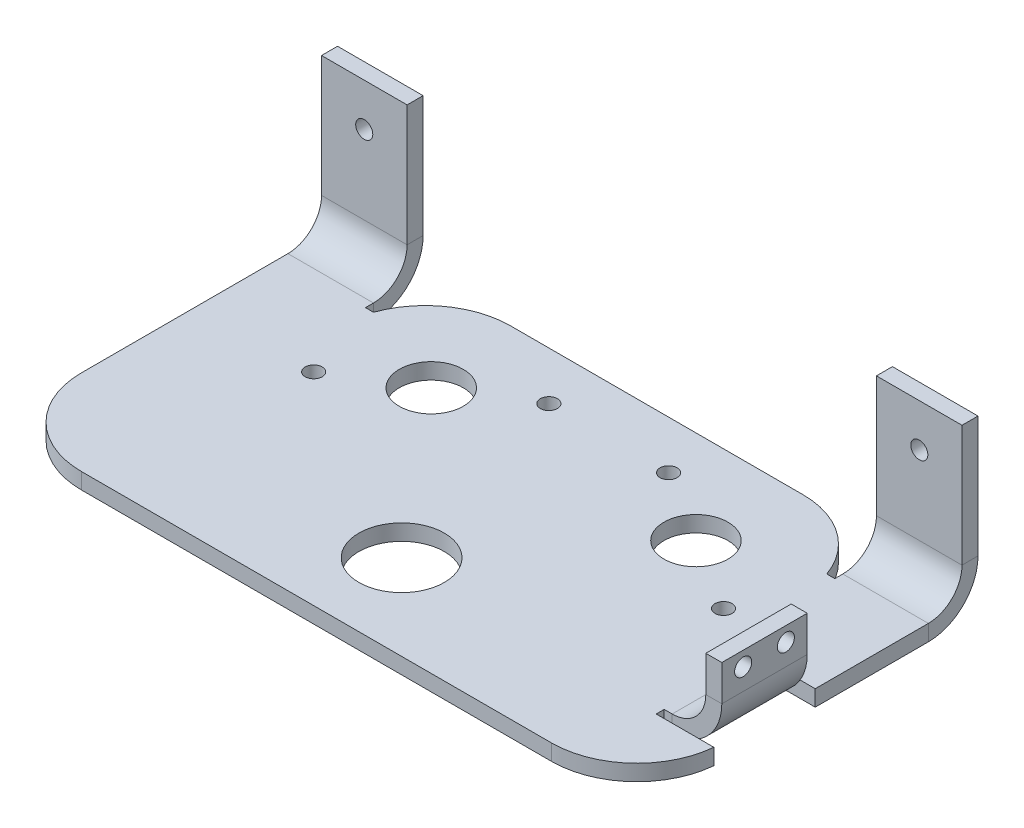
from build123d import *

# Parameters (mm, degrees)
SKETCH1_W                     = 190.5
SKETCH1_H                     = 101.6
BOSS_EXTRUDE1_DEPTH           = 1.5875
CONVERT_SOLID1_START          = -95.25
CONVERT_SOLID1_OUTLINE_W      = 3.175
CONVERT_SOLID1_OUTLINE_H      = 101.6
CONVERT_SOLID1_DEPTH          = 190.5
SKETCH35_W                    = 139.601875342
SKETCH35_H                    = 6.35
CUT_EXTRUDE7_DEPTH            = 0.254
EDGE_FLANGE1_STRIP_W          = 39.05
EDGE_FLANGE1_STRIP_H          = 4.7625
EDGE_FLANGE1_STRIP_CUT_DEPTH  = 25.449062329
EDGE_FLANGE1_RELIEF_W         = 41.43125
EDGE_FLANGE1_RELIEF_H         = 2.38125
EDGE_FLANGE1_RELIEF_CUT_DEPTH = 4.7625
EDGE_FLANGE1_DEPTH            = 25.449062329
EDGE_FLANGE2_STRIP_W          = 39.05
EDGE_FLANGE2_STRIP_H          = 4.7625
EDGE_FLANGE2_STRIP_CUT_DEPTH  = 25.449062329
EDGE_FLANGE2_RELIEF_W         = 41.43125
EDGE_FLANGE2_RELIEF_H         = 2.38125
EDGE_FLANGE2_RELIEF_CUT_DEPTH = 4.7625
EDGE_FLANGE2_DEPTH            = 25.449062329
SKETCH50_R                    = 12.713493351
CUT_EXTRUDE9_DEPTH            = 5.08
FILLET1_R                     = 25.4
CUT_EXTRUDE11_START           = -4.7625
CUT_EXTRUDE11_OUTLINE_W       = 6.35
CUT_EXTRUDE11_OUTLINE_H       = 0.00254
CUT_EXTRUDE11_OUTLINE_H_2     = 0.000254
CUT_EXTRUDE11_DEPTH           = 4.7625
EDGE_FLANGE3_STRIP_W          = 39.05
EDGE_FLANGE3_STRIP_H          = 4.7625
EDGE_FLANGE3_STRIP_CUT_DEPTH  = 25.4
EDGE_FLANGE3_RELIEF_W         = 41.43125
EDGE_FLANGE3_RELIEF_H         = 2.38125
EDGE_FLANGE3_RELIEF_CUT_DEPTH = 4.7625
EDGE_FLANGE3_DEPTH            = 25.4
SKETCH55_R                    = 2.54
CUT_EXTRUDE12_DEPTH           = 4.7625
FILLET2_R                     = 25.4
SKETCH56_R                    = 2.54
CUT_EXTRUDE13_DEPTH           = 4.7625
SKETCH57_R                    = 9.525
SKETCH57_R_2                  = 2.54
CUT_EXTRUDE14_DEPTH           = 4.7625


# Read off the part's stored shape, not the designer's step: Convert-Solid1, Cut-Extrude11
# Sheet-metal steps are written as plain solids
with BuildPart() as part:
    # Sketch1 → Boss-Extrude1 (new body)
    with BuildSketch(Plane(origin=(0, 0, 0), x_dir=(1, 0, 0), z_dir=(0, 1, 0))):
        Rectangle(SKETCH1_W, SKETCH1_H)
    extrude(amount=BOSS_EXTRUDE1_DEPTH)

    # Convert-Solid1 outline → Convert-Solid1 (add)
    with BuildSketch(Plane.YZ.offset(CONVERT_SOLID1_START)):
        with Locations((-1.5875, 0)):
            Rectangle(CONVERT_SOLID1_OUTLINE_W, CONVERT_SOLID1_OUTLINE_H)
    extrude(amount=CONVERT_SOLID1_DEPTH)

    # Sketch35 → Cut-Extrude7 (cut)
    with BuildSketch(Plane(origin=(0, 0, -50.8), x_dir=(-1, 0, 0), z_dir=(0, 0, -1))):
        Rectangle(SKETCH35_W, SKETCH35_H)
    extrude(amount=-CUT_EXTRUDE7_DEPTH, mode=Mode.SUBTRACT)

    # Edge-Flange1 strip (across the edge) → Edge-Flange1 strip cut (cut)
    with BuildSketch(Plane(origin=(95.25, 1.5875, -50.8), x_dir=(0, 0, 1), z_dir=(-1, 0, 0))):
        with Locations((-4.7625, -2.38125)):
            Rectangle(EDGE_FLANGE1_STRIP_W, EDGE_FLANGE1_STRIP_H)
    extrude(amount=EDGE_FLANGE1_STRIP_CUT_DEPTH, mode=Mode.SUBTRACT)

    # Edge-Flange1 relief (on the sheet) → Edge-Flange1 relief cut (cut)
    with BuildSketch(Plane(origin=(95.25, 1.5875, -36.0375), x_dir=(0, 0, 1), z_dir=(0, 1, 0))):
        with Locations((-18.334375, -26.639687329)):
            Rectangle(EDGE_FLANGE1_RELIEF_W, EDGE_FLANGE1_RELIEF_H)
    extrude(amount=-EDGE_FLANGE1_RELIEF_CUT_DEPTH, mode=Mode.SUBTRACT)

    # Edge-Flange1 section (across the edge) → Edge-Flange1 (add)
    with BuildSketch(Plane(origin=(95.25, 1.5875, -50.8), x_dir=(0, 0, 1), z_dir=(-1, 0, 0))):
        with BuildLine():
            Line((0, 10), (0, 46.0375))
            Line((0, 46.0375), (4.7625, 46.0375))
            Line((4.7625, 46.0375), (4.7625, 10))
            ThreePointArc((4.7625, 10), (7.691432188, 2.928932188), (14.7625, 0))
            Line((14.7625, 0), (14.7625, -4.7625))
            ThreePointArc((14.7625, -4.7625), (4.323836143, -0.438663857), (0, 10))
        make_face()
    extrude(amount=EDGE_FLANGE1_DEPTH)

    # Edge-Flange2 strip (across the edge) → Edge-Flange2 strip cut (cut)
    with BuildSketch(Plane(origin=(-69.800937671, 1.5875, -50.8), x_dir=(0, 0, 1), z_dir=(-1, 0, 0))):
        with Locations((-4.7625, -2.38125)):
            Rectangle(EDGE_FLANGE2_STRIP_W, EDGE_FLANGE2_STRIP_H)
    extrude(amount=EDGE_FLANGE2_STRIP_CUT_DEPTH, mode=Mode.SUBTRACT)

    # Edge-Flange2 relief (on the sheet) → Edge-Flange2 relief cut (cut)
    with BuildSketch(Plane(origin=(-69.800937671, 1.5875, -36.0375), x_dir=(0, 0, 1), z_dir=(0, 1, 0))):
        with Locations((-18.334375, 1.190625)):
            Rectangle(EDGE_FLANGE2_RELIEF_W, EDGE_FLANGE2_RELIEF_H)
    extrude(amount=-EDGE_FLANGE2_RELIEF_CUT_DEPTH, mode=Mode.SUBTRACT)

    # Edge-Flange2 section (across the edge) → Edge-Flange2 (add)
    with BuildSketch(Plane(origin=(-69.800937671, 1.5875, -50.8), x_dir=(0, 0, 1), z_dir=(-1, 0, 0))):
        with BuildLine():
            Line((0, 10), (0, 46.0375))
            Line((0, 46.0375), (4.7625, 46.0375))
            Line((4.7625, 46.0375), (4.7625, 10))
            ThreePointArc((4.7625, 10), (7.691432188, 2.928932188), (14.7625, 0))
            Line((14.7625, 0), (14.7625, -4.7625))
            ThreePointArc((14.7625, -4.7625), (4.323836143, -0.438663857), (0, 10))
        make_face()
    extrude(amount=EDGE_FLANGE2_DEPTH)

    # Sketch50 → Cut-Extrude9 (cut)
    with BuildSketch(Plane(origin=(0, -3.175, 0), x_dir=(-1, 0, 0), z_dir=(0, -1, 0))):
        with Locations(Location((0, -25.4, 0), (0, 0, 90))):
            Circle(SKETCH50_R)
    extrude(amount=-CUT_EXTRUDE9_DEPTH, mode=Mode.SUBTRACT)

    # Fillet1
    # the kernel refuses this fillet: 25.4 mm, written as the material it takes off along each edge
    with BuildSketch(Plane(origin=(-67.419687671, 61.417239936, -50.546), x_dir=(1, 0, 0), z_dir=(0, -1, 0))) as fillet1_piece_1:
        with BuildLine():
            CenterArc((23.931895975, 25.4), FILLET1_R, 199.575530564, 70.424469436)
            Line((0, 16.88975), (-0.478637919, 16.719545))
            ThreePointArc((-0.478637919, 16.719545), (-0.508, 8.444875), (-0.508, 0))
            Line((-0.508, 0), (0, -0.508))
            Line((0, -0.508), (23.931895975, -0.508))
            Line((23.931895975, -0.508), (23.931895975, 0))
        make_face()
    extrude(amount=124.421979873, mode=Mode.SUBTRACT)
    with BuildSketch(Plane(origin=(67.419687671, 61.417239936, -50.546), x_dir=(0, 0, 1), z_dir=(0, -1, 0))) as fillet1_piece_2:
        with BuildLine():
            CenterArc((25.4, 23.931895975), FILLET1_R, 180, 70.424469436)
            Line((0, 23.931895975), (-0.508, 23.931895975))
            Line((-0.508, 23.931895975), (-0.508, 0))
            Line((-0.508, 0), (0, -0.508))
            ThreePointArc((0, -0.508), (8.444875, -0.508), (16.719545, -0.478637919))
            Line((16.719545, -0.478637919), (16.88975, 0))
        make_face()
    extrude(amount=124.421979873, mode=Mode.SUBTRACT)

    # Cut-Extrude11 outline → Cut-Extrude11 (cut)
    with BuildSketch(Plane.XZ.offset(3.175).offset(CUT_EXTRUDE11_START)):
        with Locations((92.075, -0.001524)):
            Rectangle(CUT_EXTRUDE11_OUTLINE_W, CUT_EXTRUDE11_OUTLINE_H)
        with Locations((92.075, 25.399873)):
            Rectangle(CUT_EXTRUDE11_OUTLINE_W, CUT_EXTRUDE11_OUTLINE_H_2)
    extrude(amount=CUT_EXTRUDE11_DEPTH, mode=Mode.SUBTRACT)

    # Edge-Flange3 strip (across the edge) → Edge-Flange3 strip cut (cut)
    with BuildSketch(Plane(origin=(95.25, 1.5875, 25.399746), x_dir=(-1, 0, 0), z_dir=(0, 0, -1))):
        with Locations((-4.7625, -2.38125)):
            Rectangle(EDGE_FLANGE3_STRIP_W, EDGE_FLANGE3_STRIP_H)
    extrude(amount=EDGE_FLANGE3_STRIP_CUT_DEPTH, mode=Mode.SUBTRACT)

    # Edge-Flange3 relief (on the sheet) → Edge-Flange3 relief cut (cut)
    with BuildSketch(Plane(origin=(80.4875, 1.5875, 25.399746), x_dir=(-1, 0, 0), z_dir=(0, 1, 0))):
        with Locations((-18.334375, 1.190625)):
            Rectangle(EDGE_FLANGE3_RELIEF_W, EDGE_FLANGE3_RELIEF_H)
        with Locations((-18.334375, -26.590625)):
            Rectangle(EDGE_FLANGE3_RELIEF_W, EDGE_FLANGE3_RELIEF_H)
    extrude(amount=-EDGE_FLANGE3_RELIEF_CUT_DEPTH, mode=Mode.SUBTRACT)

    # Edge-Flange3 section (across the edge) → Edge-Flange3 (add)
    with BuildSketch(Plane(origin=(95.25, 1.5875, 25.399746), x_dir=(-1, 0, 0), z_dir=(0, 0, -1))):
        with BuildLine():
            Line((0, 10), (0, 20.6375))
            Line((0, 20.6375), (4.7625, 20.6375))
            Line((4.7625, 20.6375), (4.7625, 10))
            ThreePointArc((4.7625, 10), (7.691432188, 2.928932188), (14.7625, 0))
            Line((14.7625, 0), (14.7625, -4.7625))
            ThreePointArc((14.7625, -4.7625), (4.323836143, -0.438663857), (0, 10))
        make_face()
    extrude(amount=EDGE_FLANGE3_DEPTH)

    # Sketch55 → Cut-Extrude12 (cut)
    with BuildSketch(Plane(origin=(95.25, 0, 0), x_dir=(0, 0, -1), z_dir=(1, 0, 0))):
        with Locations(Location((-6.349746, 17.9375, 0), (0, 0, 90))):
            Circle(SKETCH55_R)
        with Locations(Location((-19.049746, 17.9375, 0), (0, 0, 90))):
            Circle(SKETCH55_R)
    extrude(amount=-CUT_EXTRUDE12_DEPTH, mode=Mode.SUBTRACT)

    # Fillet2
    # the kernel refuses this fillet: 25.4 mm, written as the material it takes off along each edge
    with BuildSketch(Plane(origin=(-95.25, 65.0875, 50.8), x_dir=(1, 0, 0), z_dir=(0, -1, 0))) as fillet2_piece_1:
        with BuildLine():
            CenterArc((FILLET2_R, -FILLET2_R), FILLET2_R, 90, 90)
            Line((0, -FILLET2_R), (-FILLET2_R * 0.02, -FILLET2_R))
            Line((-FILLET2_R * 0.02, -FILLET2_R), (-FILLET2_R * 0.02, FILLET2_R * 0.02))
            Line((-FILLET2_R * 0.02, FILLET2_R * 0.02), (FILLET2_R, FILLET2_R * 0.02))
            Line((FILLET2_R, FILLET2_R * 0.02), (FILLET2_R, 0))
        make_face()
    extrude(amount=131.7625, mode=Mode.SUBTRACT)
    with BuildSketch(Plane(origin=(95.25, -66.395391195, 50.8), x_dir=(-1, 0, 0), z_dir=(0, 1, 0))) as fillet2_piece_2:
        with BuildLine():
            CenterArc((25.288156478, -25.4), FILLET2_R, 90, 84.621196501)
            Line((0, -23.019004), (-0.50576313, -22.97138408))
            ThreePointArc((-0.50576313, -22.97138408), (-0.508, -11.509502), (-0.508, 0))
            Line((-0.508, 0), (0, 0.508))
            Line((0, 0.508), (25.288156478, 0.508))
            Line((25.288156478, 0.508), (25.288156478, 0))
        make_face()
    extrude(amount=131.203282389, mode=Mode.SUBTRACT)

    # Sketch56 → Cut-Extrude13 (cut)
    with BuildSketch(Plane(origin=(0, 0, -50.8), x_dir=(-1, 0, 0), z_dir=(0, 0, -1))):
        with Locations(Location((-82.55, 34.925, 0), (0, 0, 90))):
            Circle(SKETCH56_R)
        with Locations(Location((82.55, 34.925, 0), (0, 0, 90))):
            Circle(SKETCH56_R)
    extrude(amount=-CUT_EXTRUDE13_DEPTH, mode=Mode.SUBTRACT)

    # Sketch57 → Cut-Extrude14 (cut)
    with BuildSketch(Plane.XZ.offset(3.175)):
        with Locations(Location((39.37, -22.793111541, 0), (0, 0, 270))):
            Circle(SKETCH57_R)
        with Locations(Location((60.96, -9.412831275, 0), (0, 0, 270))):
            Circle(SKETCH57_R_2)
        with Locations(Location((17.801190198, -36.207523333, 0), (0, 0, 270))):
            Circle(SKETCH57_R_2)
        with Locations(Location((-17.801190198, -36.207523333, 0), (0, 0, 270))):
            Circle(SKETCH57_R_2)
        with Locations(Location((-39.37, -22.793111541, 0), (0, 0, 270))):
            Circle(SKETCH57_R)
        with Locations(Location((-60.96, -9.412831275, 0), (0, 0, 270))):
            Circle(SKETCH57_R_2)
    extrude(amount=-CUT_EXTRUDE14_DEPTH, mode=Mode.SUBTRACT)


solid = part.part
